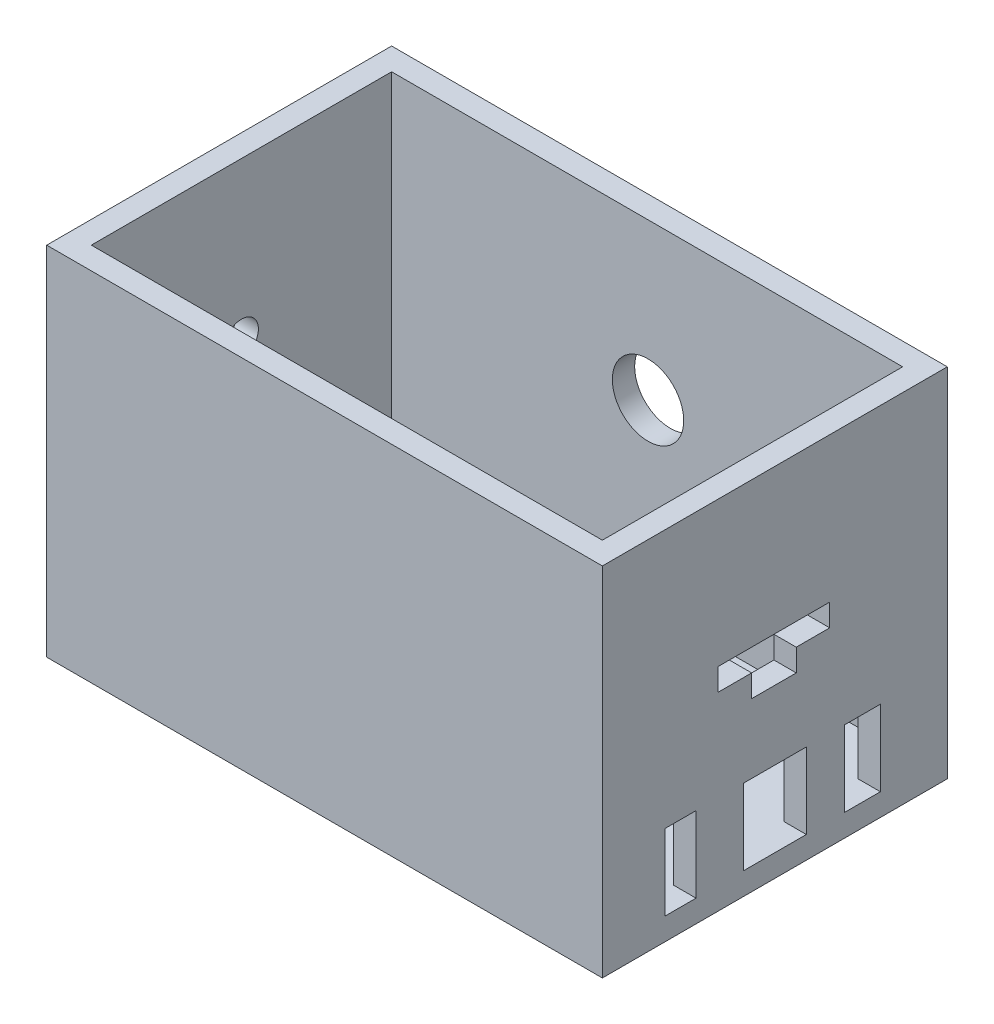
from build123d import *

# Parameters (mm, degrees)
SKETCH1_W             = 158.2
SKETCH1_H             = 98.2
BOSS_EXTRUDE1_DEPTH   = 6.35
SKETCH2_W             = 158.2
SKETCH2_H             = 95.25
BOSS_EXTRUDE2_DEPTH   = 6.35
SKETCH3_W             = 85.5
SKETCH3_H             = 95.25
BOSS_EXTRUDE3_DEPTH   = 6.35
SKETCH4_W             = 158.2
SKETCH4_H             = 95.25
BOSS_EXTRUDE4_DEPTH   = 6.35
SKETCH5_W             = 85.5
SKETCH5_H             = 73.66
BOSS_EXTRUDE5_DEPTH   = 6.35
SKETCH6_W             = 13.462
SKETCH6_H             = 21.59
SKETCH6_W_2           = 10.922
SKETCH6_W_3           = 11.43
SKETCH6_W_4           = 12.7
BOSS_EXTRUDE6_DEPTH   = 6.35
KES_EKSTR_ZYON1_DEPTH = 6.35
IZIM3_R               = 10.16
KES_EKSTR_ZYON2_DEPTH = 6.35
IZIM4_R               = 4.826
KES_EKSTR_ZYON3_DEPTH = 6.35


with BuildPart() as part:
    # Sketch1 → Boss-Extrude1 (new body)
    with BuildSketch(Plane(origin=(0, 0, 0), x_dir=(1, 0, 0), z_dir=(0, 1, 0))):
        Rectangle(SKETCH1_W, SKETCH1_H)
    extrude(amount=BOSS_EXTRUDE1_DEPTH)

    # Sketch2 → Boss-Extrude2 (add)
    with BuildSketch(Plane.XY.offset(49.1)):
        with Locations((0, 53.975)):
            Rectangle(SKETCH2_W, SKETCH2_H)
    extrude(amount=-BOSS_EXTRUDE2_DEPTH)

    # Sketch3 → Boss-Extrude3 (add)
    with BuildSketch(Plane.ZY.offset(79.1)):
        with Locations((0, 53.975)):
            Rectangle(SKETCH3_W, SKETCH3_H)
    extrude(amount=-BOSS_EXTRUDE3_DEPTH)

    # Sketch4 → Boss-Extrude4 (add)
    with BuildSketch(Plane(origin=(0, 0, -49.1), x_dir=(-1, 0, 0), z_dir=(0, 0, -1))):
        with Locations((0, 53.975)):
            Rectangle(SKETCH4_W, SKETCH4_H)
    extrude(amount=-BOSS_EXTRUDE4_DEPTH)

    # Sketch5 → Boss-Extrude5 (add)
    with BuildSketch(Plane(origin=(79.1, 0, 0), x_dir=(0, 0, -1), z_dir=(1, 0, 0))):
        with Locations((0, 64.77)):
            Rectangle(SKETCH5_W, SKETCH5_H)
    extrude(amount=-BOSS_EXTRUDE5_DEPTH)

    # Sketch6 → Boss-Extrude6 (add)
    with BuildSketch(Plane(origin=(79.1, 0, 0), x_dir=(0, 0, -1), z_dir=(1, 0, 0))):
        with Locations((-15.699, 17.145)):
            Rectangle(SKETCH6_W, SKETCH6_H)
        with Locations((14.429, 17.145)):
            Rectangle(SKETCH6_W_2, SKETCH6_H)
        with Locations((-37.035, 17.145)):
            Rectangle(SKETCH6_W_3, SKETCH6_H)
        with Locations((36.4, 17.145)):
            Rectangle(SKETCH6_W_4, SKETCH6_H)
    extrude(amount=-BOSS_EXTRUDE6_DEPTH)

    # Çizim2 → Kes-Ekstrüzyon1 (cut)
    with BuildSketch(Plane(origin=(79.1, 0, 0), x_dir=(0, 0, -1), z_dir=(1, 0, 0))):
        Polygon((-16.125, 60.325), (15.625, 60.325), (15.625, 53.975), (6.10000009, 53.975), (6.10000009, 47.625), (-6.59999991, 47.625), (-6.59999991, 53.975), (-16.125, 53.975), align=None)
    extrude(amount=-KES_EKSTR_ZYON1_DEPTH, mode=Mode.SUBTRACT)

    # Çizim3 → Kes-Ekstrüzyon2 (cut)
    with BuildSketch(Plane(origin=(0, 0, -49.1), x_dir=(-1, 0, 0), z_dir=(0, 0, -1))):
        with Locations((-0.250018, 57.15)):
            Circle(IZIM3_R)
    extrude(amount=-KES_EKSTR_ZYON2_DEPTH, mode=Mode.SUBTRACT)

    # Çizim4 → Kes-Ekstrüzyon3 (cut)
    with BuildSketch(Plane.ZY.offset(79.1)):
        with Locations((0, 57.15)):
            Circle(IZIM4_R)
    extrude(amount=-KES_EKSTR_ZYON3_DEPTH, mode=Mode.SUBTRACT)


solid = part.part
